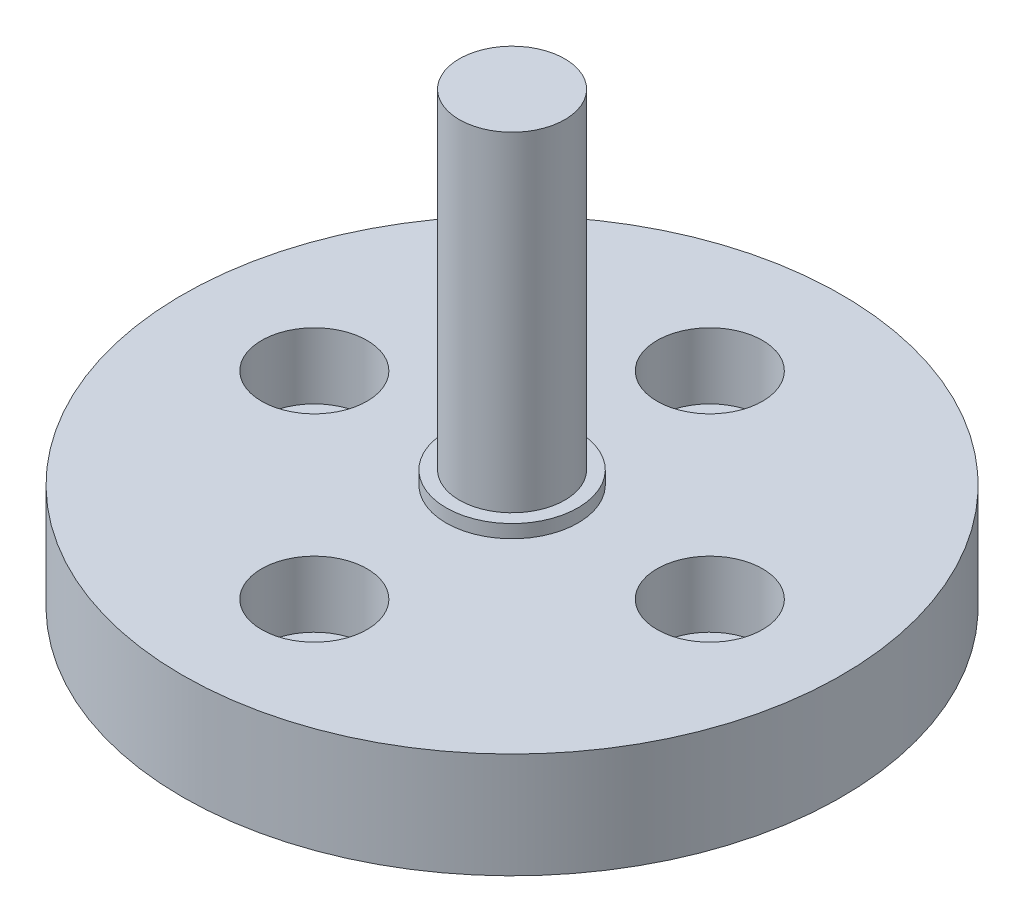
from build123d import *

# Parameters (mm, degrees)
SKETCH1_R           = 25
BOSS_EXTRUDE1_DEPTH = 8
SKETCH2_R           = 5
BOSS_EXTRUDE2_DEPTH = 1
SKETCH3_R           = 4
BOSS_EXTRUDE3_DEPTH = 15
HOLE1_D             = 4
HOLE1_CBORE_D       = 8
HOLE1_CBORE_DEPTH   = 5
SKETCH8_R           = 4
BOSS_EXTRUDE4_DEPTH = 10


with BuildPart() as part:
    # Sketch1 → Boss-Extrude1 (new body)
    with BuildSketch(Plane(origin=(0, 0, 0), x_dir=(1, 0, 0), z_dir=(0, 1, 0))):
        Circle(SKETCH1_R)
    extrude(amount=BOSS_EXTRUDE1_DEPTH)

    # Sketch2 → Boss-Extrude2 (add)
    with BuildSketch(Plane(origin=(0, 8, 0), x_dir=(1, 0, 0), z_dir=(0, 1, 0))):
        Circle(SKETCH2_R)
    extrude(amount=BOSS_EXTRUDE2_DEPTH)

    # Sketch3 → Boss-Extrude3 (add)
    with BuildSketch(Plane(origin=(0, 9, 0), x_dir=(1, 0, 0), z_dir=(0, 1, 0))):
        Circle(SKETCH3_R)
    extrude(amount=BOSS_EXTRUDE3_DEPTH)

    # Hole1 (through all)
    with Locations(Plane(origin=(0, 8, 0), x_dir=(1, 0, 0), z_dir=(0, 1, 0))):
        with Locations((-15, 0), (0, 15), (15, 0), (0, -15)):
            CounterBoreHole(HOLE1_D / 2, HOLE1_CBORE_D / 2, HOLE1_CBORE_DEPTH)

    # Sketch8 → Boss-Extrude4 (add)
    with BuildSketch(Plane(origin=(0, 24, 0), x_dir=(1, 0, 0), z_dir=(0, 1, 0))):
        Circle(SKETCH8_R)
    extrude(amount=BOSS_EXTRUDE4_DEPTH)


solid = part.part
